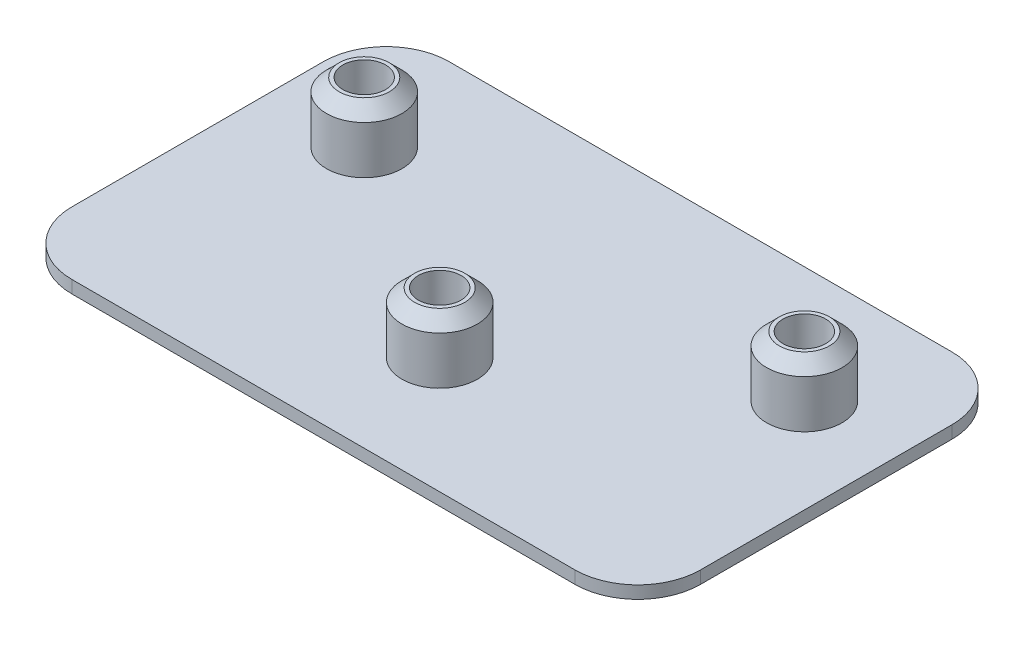
from build123d import *

# Parameters (mm, degrees)
SKETCH_1_W                   = 50
SKETCH_1_H                   = 30
EXTRUDE_1_DEPTH              = 1
SKETCH_1_3_R                 = 3
EXTRUDE_2_DEPTH              = 5.8
HOLE_WIZARD_M3_1_D           = 3.4
HOLE_WIZARD_M3_1_DEPTH       = 7.5
HOLE_WIZARD_M3_1_CSINK_D     = 6.4
HOLE_WIZARD_M3_1_CSINK_ANGLE = 90
HOLE_WIZARD_M3_1_TIP         = 1.021463052
CHAMFER_1_SIZE               = 1
FILLET_1_R                   = 5


with BuildPart() as part:
    # 草图1 → 凸台-拉伸1 (new body)
    with BuildSketch(Plane(origin=(0, 0, 0), x_dir=(1, 0, 0), z_dir=(0, 1, 0))):
        Rectangle(SKETCH_1_W, SKETCH_1_H)
    extrude(amount=EXTRUDE_1_DEPTH)

    # 草图1<3> → 凸台-拉伸2 (add)
    with BuildSketch(Plane(origin=(0, 0, 0), x_dir=(1, 0, 0), z_dir=(0, 1, 0))):
        with Locations((-17.5, 5.75)):
            Circle(SKETCH_1_3_R)
        with Locations((17.5, 5.75)):
            Circle(SKETCH_1_3_R)
        with Locations((0, -5.75)):
            Circle(SKETCH_1_3_R)
    extrude(amount=EXTRUDE_2_DEPTH)

    # M3 平头机械螺钉的锥形沉头孔1
    with Locations(Plane(origin=(0, 0, 0), x_dir=(-1, 0, 0), z_dir=(0, -1, 0))):
        with Locations((-17.5, 5.75), (0, -5.75), (17.5, 5.75)):
            CounterSinkHole(HOLE_WIZARD_M3_1_D / 2, HOLE_WIZARD_M3_1_CSINK_D / 2, depth=HOLE_WIZARD_M3_1_DEPTH, counter_sink_angle=HOLE_WIZARD_M3_1_CSINK_ANGLE)
            with Locations((0, 0, -(HOLE_WIZARD_M3_1_DEPTH + HOLE_WIZARD_M3_1_TIP / 2))):  # 118° drill point
                Cone(0, HOLE_WIZARD_M3_1_D / 2, HOLE_WIZARD_M3_1_TIP, mode=Mode.SUBTRACT)

    # 倒角1
    chamfer_1_edges = [part.edges().sort_by_distance(p)[0] for p in [
        (-20.5, 5.8, -5.75),
        (-3, 5.8, 5.75),
        (14.5, 5.8, -5.75),
    ]]
    chamfer(chamfer_1_edges, length=CHAMFER_1_SIZE)

    # 圆角1
    fillet_1_edges = [part.edges().sort_by_distance(p)[0] for p in [
        (-25, 0.5, 15),
        (-25, 0.5, -15),
        (25, 0.5, -15),
        (25, 0.5, 15),
    ]]
    fillet(fillet_1_edges, radius=FILLET_1_R)


solid = part.part
